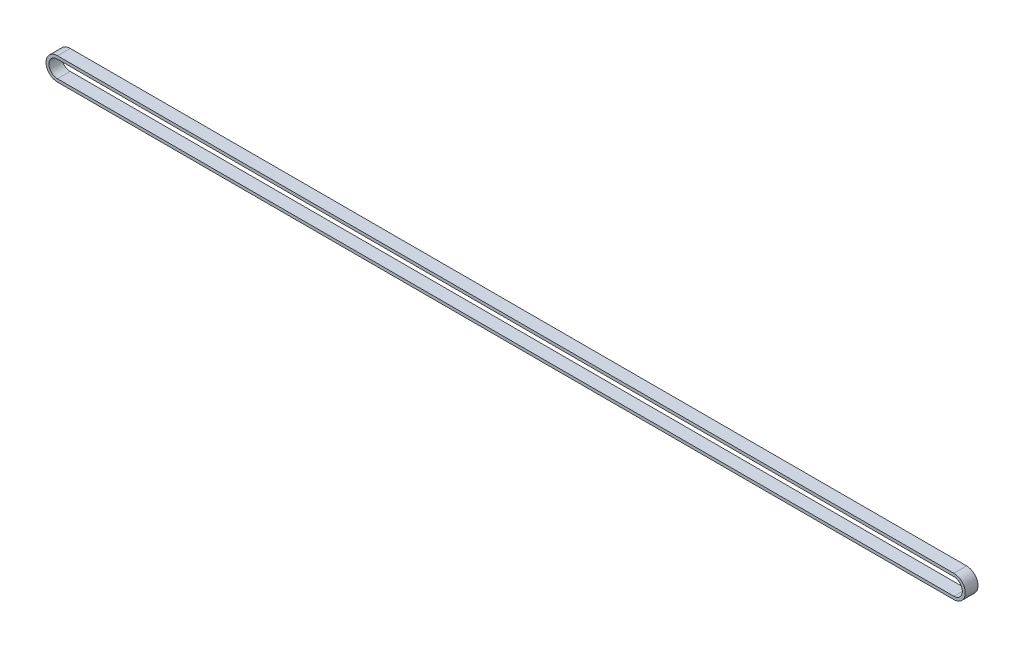
from build123d import *

# Parameters (mm, degrees)
BOSS_EXTRUDE1_DEPTH = 6


with BuildPart() as part:
    # Sketch1 → Boss-Extrude1 (new body)
    with BuildSketch(Plane.XY):
        with BuildLine():
            Line((-211, 5.38), (211, 5.38))
            ThreePointArc((211, 5.38), (216.38, 0), (211, -5.38))
            Line((211, -5.38), (-211, -5.38))
            ThreePointArc((-211, -5.38), (-216.38, 0), (-211, 5.38))
        make_face()
        with BuildLine():
            Line((-211, -4), (211, -4))
            ThreePointArc((211, -4), (215, 0), (211, 4))
            Line((211, 4), (-211, 4))
            ThreePointArc((-211, 4), (-215, 0), (-211, -4))
        make_face(mode=Mode.SUBTRACT)
    extrude(amount=BOSS_EXTRUDE1_DEPTH)


solid = part.part
